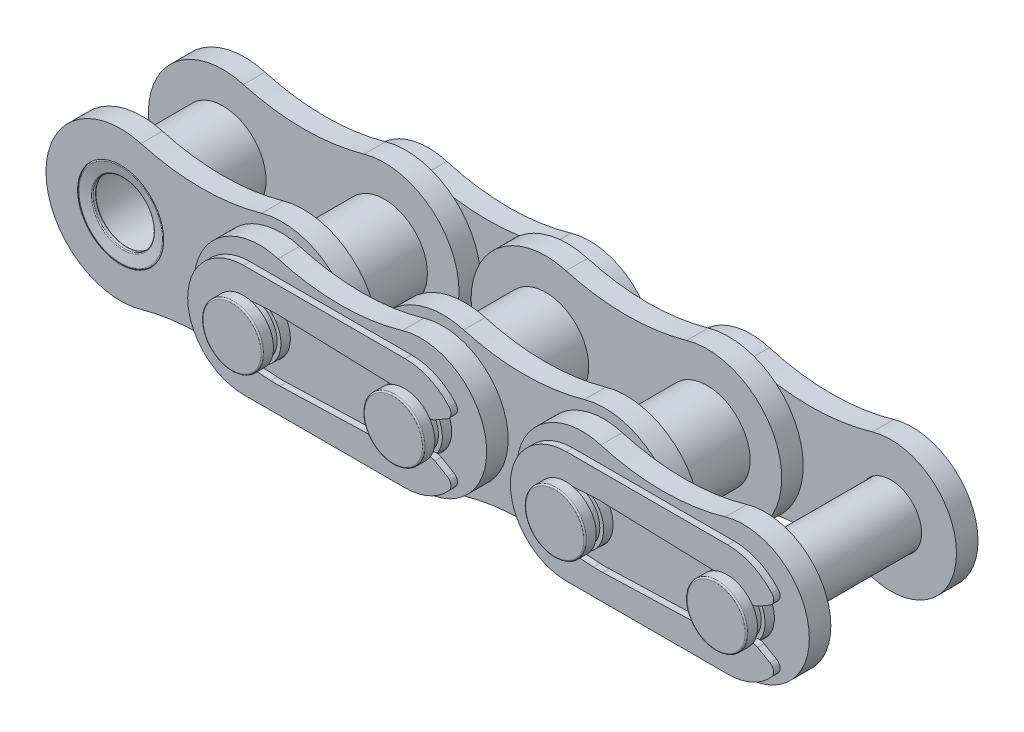
from build123d import *

# Parameters (mm, degrees)
SKETCH4_R                  = 2.54
SKETCH4_R_2                = 1.8161
BOSS_EXTRUDE1_DEPTH        = 3.6576
BOSS_EXTRUDE1_2_DEPTH      = 3.6576
SKETCH5_R                  = 2.54
BOSS_EXTRUDE2_DEPTH        = 1.27
LPATTERN1_COUNT            = 2
LPATTERN1_PITCH            = 9.525
SKETCH7_R                  = 1.8161
BOSS_EXTRUDE3_DEPTH        = 1.27
BOSS_EXTRUDE4_DEPTH        = 6.604
BOSS_EXTRUDE4_DEPTH_BACK   = 5.9182
SKETCH8_R                  = 1.7907
BOSS_EXTRUDE4_2_DEPTH      = 6.604
BOSS_EXTRUDE4_2_DEPTH_BACK = 5.9182
SKETCH12_R                 = 2.1936075
BOSS_EXTRUDE5_DEPTH        = 0.9144
FILLET1_R                  = 0.3429
FILLET2_R                  = 0.3429
FILLET3_R                  = 0.08001
FILLET4_R                  = 0.08001
CUT_EXTRUDE1_START         = -0.8763
SKETCH14_R                 = 1.8161
SKETCH14_R_2               = 1.5621
CUT_EXTRUDE1_DEPTH         = 0.219075
BOSS_EXTRUDE6_START        = -0.8763
BOSS_EXTRUDE6_DEPTH        = 0.191690625
LPATTERN2_COUNT            = 2
LPATTERN2_PITCH            = 19.05


# Read off the part's stored shape, not the designer's step: Body-Delete1
with BuildPart() as part:
    # Sketch4 → Boss-Extrude1 (new, symmetric)
    with BuildSketch(Plane.XY):
        with Locations((-4.7625, 0)):
            Circle(SKETCH4_R)
        with Locations((-4.7625, 0)):
            Circle(SKETCH4_R_2, mode=Mode.SUBTRACT)
    extrude(amount=BOSS_EXTRUDE1_DEPTH, both=True)

    # Sketch10 → Cut-Revolve1 (revolve, cut)
    with BuildSketch(Plane(origin=(0, 0, 0), x_dir=(1, 0, 0), z_dir=(0, 1, 0)), mode=Mode.PRIVATE) as cut_revolve1_sk:
        with BuildLine():
            Line((-6.619875, -3.28295), (-6.95325, -3.28295))
            Line((-6.95325, -3.28295), (-6.95325, 3.28295))
            Line((-6.95325, 3.28295), (-6.619875, 3.28295))
            ThreePointArc((-6.619875, 3.28295), (-6.590689168, 3.295039168), (-6.5786, 3.324225))
            Line((-6.5786, 3.324225), (-6.5786, 3.461770456))
            ThreePointArc((-6.5786, 3.461770456), (-6.592577335, 3.501516596), (-6.628356085, 3.523765252))
            Line((-6.628356085, 3.523765252), (-7.225256085, 3.656094796))
            ThreePointArc((-7.225256085, 3.656094796), (-7.27874614, 3.643622665), (-7.3025, 3.5941))
            Line((-7.3025, 3.5941), (-7.3025, 3.9751))
            Line((-7.3025, 3.9751), (-4.7625, 3.9751))
            Line((-4.7625, 3.9751), (-4.7625, -3.9751))
            Line((-4.7625, -3.9751), (-7.3025, -3.9751))
            Line((-7.3025, -3.9751), (-7.3025, -3.5941))
            ThreePointArc((-7.3025, -3.5941), (-7.27874614, -3.643622665), (-7.225256085, -3.656094796))
            Line((-7.225256085, -3.656094796), (-6.628356085, -3.523765252))
            ThreePointArc((-6.628356085, -3.523765252), (-6.592577335, -3.501516596), (-6.5786, -3.461770456))
            Line((-6.5786, -3.461770456), (-6.5786, -3.324225))
            ThreePointArc((-6.5786, -3.324225), (-6.590689168, -3.295039168), (-6.619875, -3.28295))
        make_face()
    revolve(cut_revolve1_sk.sketch.rotate(Axis((-4.7625, 0, 3.9751), (0, 0, -1)), 180), axis=Axis((-4.7625, 0, 3.9751), (0, 0, -1)), mode=Mode.SUBTRACT)


with BuildPart() as body_2:
    # Sketch4 → Boss-Extrude1 2 (new, symmetric)
    with BuildSketch(Plane.XY):
        with Locations((4.7625, 0)):
            Circle(SKETCH4_R)
        with Locations((4.7625, 0)):
            Circle(SKETCH4_R_2, mode=Mode.SUBTRACT)
    extrude(amount=BOSS_EXTRUDE1_2_DEPTH, both=True)

    # Sketch11 → Cut-Revolve2 (revolve, cut)
    with BuildSketch(Plane(origin=(0, 0, 0), x_dir=(1, 0, 0), z_dir=(0, 1, 0))):
        with BuildLine():
            Line((7.225256085, 3.656094796), (6.628356085, 3.523765252))
            ThreePointArc((6.628356085, 3.523765252), (6.592577335, 3.501516596), (6.5786, 3.461770456))
            Line((6.5786, 3.461770456), (6.5786, 3.324225))
            ThreePointArc((6.5786, 3.324225), (6.590689168, 3.295039168), (6.619875, 3.28295))
            Line((6.619875, 3.28295), (6.95325, 3.28295))
            Line((6.95325, 3.28295), (6.95325, -3.28295))
            Line((6.95325, -3.28295), (6.619875, -3.28295))
            ThreePointArc((6.619875, -3.28295), (6.590689168, -3.295039168), (6.5786, -3.324225))
            Line((6.5786, -3.324225), (6.5786, -3.461770456))
            ThreePointArc((6.5786, -3.461770456), (6.592577335, -3.501516596), (6.628356085, -3.523765252))
            Line((6.628356085, -3.523765252), (7.225256085, -3.656094796))
            ThreePointArc((7.225256085, -3.656094796), (7.27874614, -3.643622665), (7.3025, -3.5941))
            Line((7.3025, -3.5941), (7.3025, -3.9751))
            Line((7.3025, -3.9751), (4.7625, -3.9751))
            Line((4.7625, -3.9751), (4.7625, 3.9751))
            Line((4.7625, 3.9751), (7.3025, 3.9751))
            Line((7.3025, 3.9751), (7.3025, 3.5941))
            ThreePointArc((7.3025, 3.5941), (7.27874614, 3.643622665), (7.225256085, 3.656094796))
        make_face()
    revolve(axis=Axis((4.7625, 0, 3.9751), (0, 0, -1)), mode=Mode.SUBTRACT)


with BuildPart() as body_3:
    # Sketch5 → Boss-Extrude2 (new body)
    with BuildSketch(Plane.XY.offset(2.3876)):
        with BuildLine():
            ThreePointArc((-3.562267566, 4.240307738), (-9.1694, 0), (-3.562267566, -4.240307738))
            ThreePointArc((-3.562267566, -4.240307738), (0, -3.745865), (3.562267566, -4.240307738))
            ThreePointArc((3.562267566, -4.240307738), (9.1694, 0), (3.562267566, 4.240307738))
            ThreePointArc((3.562267566, 4.240307738), (0, 3.745865), (-3.562267566, 4.240307738))
        make_face()
        with Locations((-4.7625, 0)):
            Circle(SKETCH5_R, mode=Mode.SUBTRACT)
        with Locations((4.7625, 0)):
            Circle(SKETCH5_R, mode=Mode.SUBTRACT)
    extrude(amount=BOSS_EXTRUDE2_DEPTH)


with BuildPart() as lpattern1_1:
    # LPattern1: pattern copy
    add(body_2.part.moved(Location(Vector(1, 0, 0) * (1 * LPATTERN1_PITCH))))


with BuildPart() as body_5:
    # Sketch7 → Boss-Extrude3 (new body)
    with BuildSketch(Plane.XY.offset(-3.7084)):
        with BuildLine():
            ThreePointArc((5.851642473, 3.721990208), (0.884428, 0), (5.851642473, -3.721990208))
            ThreePointArc((5.851642473, -3.721990208), (9.525, -3.195572188), (13.198357527, -3.721990208))
            ThreePointArc((13.198357527, -3.721990208), (18.165572, 0), (13.198357527, 3.721990208))
            ThreePointArc((13.198357527, 3.721990208), (9.525, 3.195572188), (5.851642473, 3.721990208))
        make_face()
        with Locations((4.7625, 0)):
            Circle(SKETCH7_R, mode=Mode.SUBTRACT)
        with Locations((14.2875, 0)):
            Circle(SKETCH7_R, mode=Mode.SUBTRACT)
    extrude(amount=-BOSS_EXTRUDE3_DEPTH)


with BuildPart() as body_6:
    # Mirror1: mirrored copy
    add(body_3.part.mirror(Plane.XY))


with BuildPart() as body_7:
    # Mirror1 2: mirrored copy
    add(body_5.part.mirror(Plane.XY))


with BuildPart() as body_8:
    # Sketch8 → Boss-Extrude4 (new, two sides: drawn at the far end of the back side and taken through both)
    with BuildSketch(Plane.XY.offset(-BOSS_EXTRUDE4_DEPTH_BACK)):
        with Locations(Location((4.7625, 0, 0), (0, 0, 180))):
            Circle(SKETCH8_R)
    extrude(amount=BOSS_EXTRUDE4_DEPTH + BOSS_EXTRUDE4_DEPTH_BACK)



with BuildPart() as body_9:
    # Sketch8 → Boss-Extrude4 2 (new, two sides: drawn at the far end of the back side and taken through both)
    with BuildSketch(Plane.XY.offset(-BOSS_EXTRUDE4_2_DEPTH_BACK)):
        with Locations(Location((14.2875, 0, 0), (0, 0, 180))):
            Circle(SKETCH8_R)
    extrude(amount=BOSS_EXTRUDE4_2_DEPTH + BOSS_EXTRUDE4_2_DEPTH_BACK)


with BuildPart() as body_8_1:
    add(body_8.part)

    add(body_9.part)  # Boss-Extrude5 merges body 9
    # Sketch12 → Boss-Extrude5 (add)
    with BuildSketch(Plane(origin=(0, 0, -5.9182), x_dir=(-1, 0, 0), z_dir=(0, 0, -1))):
        with Locations((-4.7625, 0)):
            Circle(SKETCH12_R)
        with Locations((-14.2875, 0)):
            Circle(SKETCH12_R)
    extrude(amount=-BOSS_EXTRUDE5_DEPTH)

    # Fillet1
    fillet1_edges = [body_8_1.edges().sort_by_distance(p)[0] for p in [
        (6.9561075, 0, -5.9182),
        (6.9561075, 0, -5.0038),
    ]]
    fillet(fillet1_edges, radius=FILLET1_R)

    # Fillet2
    fillet2_edges = [body_8_1.edges().sort_by_distance(p)[0] for p in [
        (16.4811075, 0, -5.9182),
        (16.4811075, 0, -5.0038),
    ]]
    fillet(fillet2_edges, radius=FILLET2_R)

    # Fillet3
    fillet3_edges = [body_8_1.edges().sort_by_distance(p)[0] for p in [
        (6.5532, 0, 6.604),
    ]]
    fillet(fillet3_edges, radius=FILLET3_R)

    # Fillet4
    fillet4_edges = [body_8_1.edges().sort_by_distance(p)[0] for p in [
        (16.0782, 0, 6.604),
    ]]
    fillet(fillet4_edges, radius=FILLET4_R)

    # Sketch14 → Cut-Extrude1 (cut, symmetric)
    # profile 1 of 2: a face of its own
    with BuildSketch(Plane.XY.offset(6.604).offset(CUT_EXTRUDE1_START)):
        with Locations((4.7625, 0)):
            Circle(SKETCH14_R)
        with Locations((4.7625, 0)):
            Circle(SKETCH14_R_2, mode=Mode.SUBTRACT)
    # profile 2 of 2: a face of its own
    with BuildSketch(Plane.XY.offset(6.604).offset(CUT_EXTRUDE1_START)):
        with Locations((14.2875, 0)):
            Circle(SKETCH14_R)
        with Locations((14.2875, 0)):
            Circle(SKETCH14_R_2, mode=Mode.SUBTRACT)
    extrude(amount=CUT_EXTRUDE1_DEPTH, both=True, mode=Mode.SUBTRACT)


with BuildPart() as body_9_2:
    # Sketch15 → Boss-Extrude6 (new, symmetric)
    with BuildSketch(Plane.XY.offset(6.604).offset(BOSS_EXTRUDE6_START)):
        with BuildLine():
            Line((4.659569472, 1.68289925), (6.360949696, 1.786960123))
            ThreePointArc((6.360949696, 1.786960123), (6.628447867, 1.797114961), (6.896129409, 1.794882204))
            Line((6.896129409, 1.794882204), (14.2875, 1.5621))
            ThreePointArc((14.2875, 1.5621), (14.866127194, 1.450981385), (15.362434112, 1.133434191))
            ThreePointArc((15.362434112, 1.133434191), (15.692557716, 0.978709135), (16.049657497, 1.05220188))
            Line((16.049657497, 1.05220188), (16.782003472, 1.475022026))
            ThreePointArc((16.782003472, 1.475022026), (16.993399294, 1.781809155), (16.888881496, 2.139415874))
            ThreePointArc((16.888881496, 2.139415874), (15.712822773, 3.000410732), (14.2875, 3.305175))
            Line((14.2875, 3.305175), (4.7625, 3.305175))
            ThreePointArc((4.7625, 3.305175), (1.457325, 0), (4.7625, -3.305175))
            Line((4.7625, -3.305175), (14.2875, -3.305175))
            ThreePointArc((14.2875, -3.305175), (15.712822773, -3.000410732), (16.888881496, -2.139415874))
            ThreePointArc((16.888881496, -2.139415874), (16.993399294, -1.781809155), (16.782003472, -1.475022026))
            Line((16.782003472, -1.475022026), (16.049657497, -1.05220188))
            ThreePointArc((16.049657497, -1.05220188), (15.692557716, -0.978709135), (15.362434112, -1.133434191))
            ThreePointArc((15.362434112, -1.133434191), (14.866127194, -1.450981385), (14.2875, -1.5621))
            Line((14.2875, -1.5621), (6.896129409, -1.794882204))
            ThreePointArc((6.896129409, -1.794882204), (6.628447867, -1.797114961), (6.360949696, -1.786960123))
            Line((6.360949696, -1.786960123), (4.659569472, -1.68289925))
            ThreePointArc((4.659569472, -1.68289925), (3.076455937, 0), (4.659569472, 1.68289925))
        make_face()
    extrude(amount=BOSS_EXTRUDE6_DEPTH, both=True)


with BuildPart() as lpattern2_1:
    # LPattern2: pattern copy
    add(part.part.moved(Location(Vector(1, 0, 0) * (1 * LPATTERN2_PITCH))))


with BuildPart() as lpattern2_2:
    # LPattern2: pattern copy
    add(body_2.part.moved(Location(Vector(1, 0, 0) * (1 * LPATTERN2_PITCH))))


with BuildPart() as lpattern2_3:
    # LPattern2: pattern copy
    add(body_3.part.moved(Location(Vector(1, 0, 0) * (1 * LPATTERN2_PITCH))))


with BuildPart() as lpattern2_4:
    # LPattern2: pattern copy
    add(lpattern1_1.part.moved(Location(Vector(1, 0, 0) * (1 * LPATTERN2_PITCH))))


with BuildPart() as lpattern2_5:
    # LPattern2: pattern copy
    add(body_5.part.moved(Location(Vector(1, 0, 0) * (1 * LPATTERN2_PITCH))))


with BuildPart() as lpattern2_6:
    # LPattern2: pattern copy
    add(body_6.part.moved(Location(Vector(1, 0, 0) * (1 * LPATTERN2_PITCH))))


with BuildPart() as lpattern2_7:
    # LPattern2: pattern copy
    add(body_7.part.moved(Location(Vector(1, 0, 0) * (1 * LPATTERN2_PITCH))))


with BuildPart() as lpattern2_8:
    # LPattern2: pattern copy
    add(body_8_1.part.moved(Location(Vector(1, 0, 0) * (1 * LPATTERN2_PITCH))))


with BuildPart() as lpattern2_9:
    # LPattern2: pattern copy
    add(body_9_2.part.moved(Location(Vector(1, 0, 0) * (1 * LPATTERN2_PITCH))))


solid = Compound([part.part, body_2.part, body_3.part, body_5.part, body_6.part, body_7.part, body_8_1.part, body_9_2.part, lpattern2_1.part, lpattern2_2.part, lpattern2_3.part, lpattern2_5.part, lpattern2_6.part, lpattern2_7.part, lpattern2_8.part, lpattern2_9.part])
